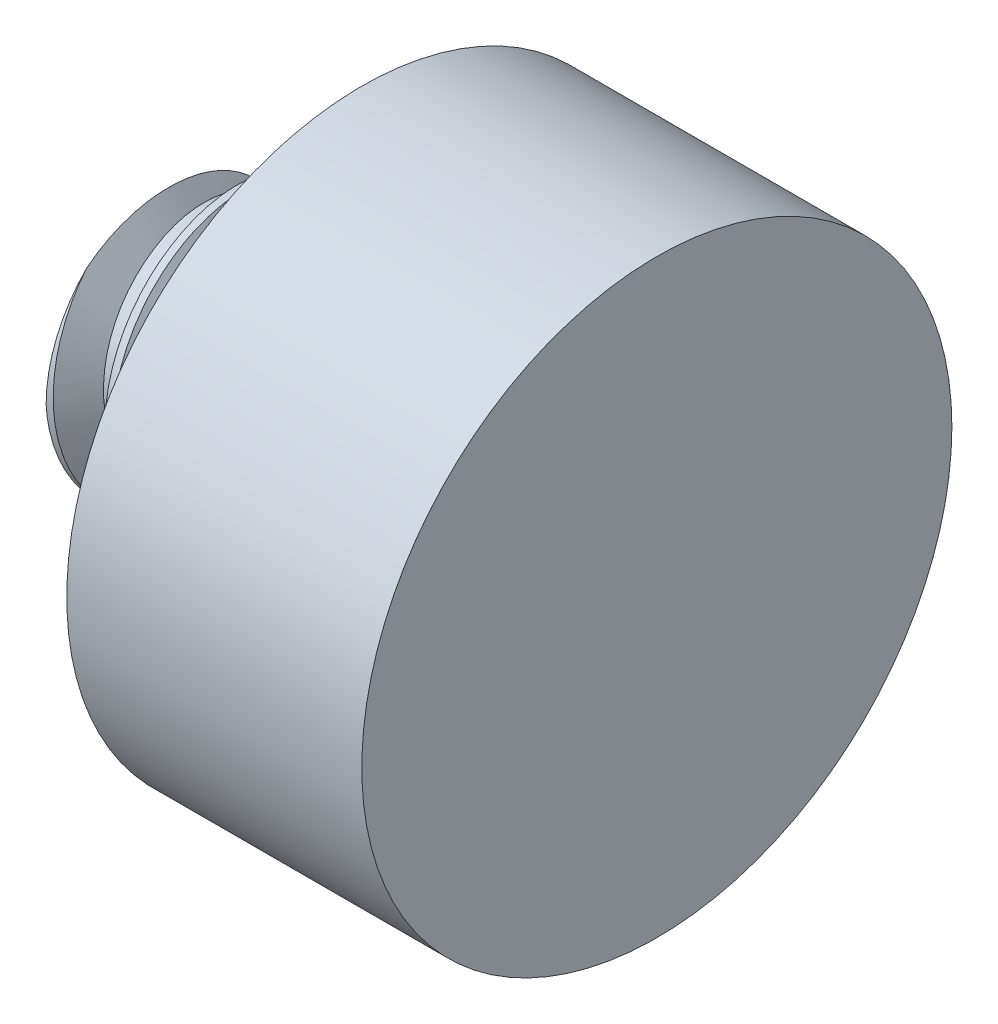
from build123d import *

# Parameters (mm, degrees)
THREAD1_PITCH = 1.27


with BuildPart() as part:
    # Sketch1 → Revolve1 (revolve)
    with BuildSketch(Plane.XY, mode=Mode.PRIVATE) as revolve1_sk:
        Polygon((0, 0), (0, 2.9845), (3.81, 2.9845), (3.81, 6.35), (10.16, 6.35), (10.16, 0), align=None)
    revolve(revolve1_sk.sketch.rotate(Axis((10.16, 0, 0), (-1, 0, 0)), 90), axis=Axis((10.16, 0, 0), (-1, 0, 0)))

    # Thread1: the profile of Thread Profile1 profile screwed along a right-hand helix of 3 turns, 8 arcs to a turn; built about Z, then put on its axis
    thread1_z = Axis((0, 0, 0), (0, 0, 1))
    thread1_corners = [(2.9848, 0, -0.000173205), (2.9848, 0, 1.111423202), (2.297092339, 0, 0.714374998), (2.297092339, 0, 0.396874998)]
    with BuildLine(mode=Mode.PRIVATE) as thread1_profile:
        Line(thread1_corners[0], thread1_corners[1])
        Line(thread1_corners[1], thread1_corners[2])
        Line(thread1_corners[2], thread1_corners[3])
        Line(thread1_corners[3], thread1_corners[0])
    thread1_cap = Face(thread1_profile.wire())
    thread1_turn_angles = [0, 22.5, 45, 67.5, 90, 112.5, 135, 157.5, 180, 202.5, 225, 247.5, 270, 292.5, 315, 337.5, 360]
    thread1_turn_weights = [1, 0.9238795325112867, 1, 0.9238795325112867, 1, 0.9238795325112867, 1, 0.9238795325112867, 1, 0.9238795325112867, 1, 0.9238795325112867, 1, 0.9238795325112867, 1, 0.9238795325112867, 1]
    thread1_turn_rails = [Edge.make_bspline([Vector(p[0], p[1], 0).rotate(thread1_z, thread1_turn_angles[k]) / thread1_turn_weights[k] + Vector(0, 0, p[2] + THREAD1_PITCH * thread1_turn_angles[k] / 360) for k in range(17)], [0, 0, 0, 1, 1, 2, 2, 3, 3, 4, 4, 5, 5, 6, 6, 7, 7, 8, 8, 8], 2, thread1_turn_weights) for p in thread1_corners]
    thread1_turn_sides = [Face.make_surface_from_curves(thread1_turn_rails[p[0]], thread1_turn_rails[p[1]]) for p in [(0, 1), (1, 2), (2, 3), (3, 0)]]
    thread1 = Plane(origin=(3.81, 0, 0), x_dir=(0, 0, 1), z_dir=(-1, 0, 0)) * Solid(Shell([*[p.moved(Location((0, 0, THREAD1_PITCH * i))) for i in range(3) for p in thread1_turn_sides], thread1_cap, thread1_cap.rotate(thread1_z, 1080).moved(Location((0, 0, THREAD1_PITCH * 1080 / 360)))]))
    add(thread1, mode=Mode.SUBTRACT)


solid = part.part
